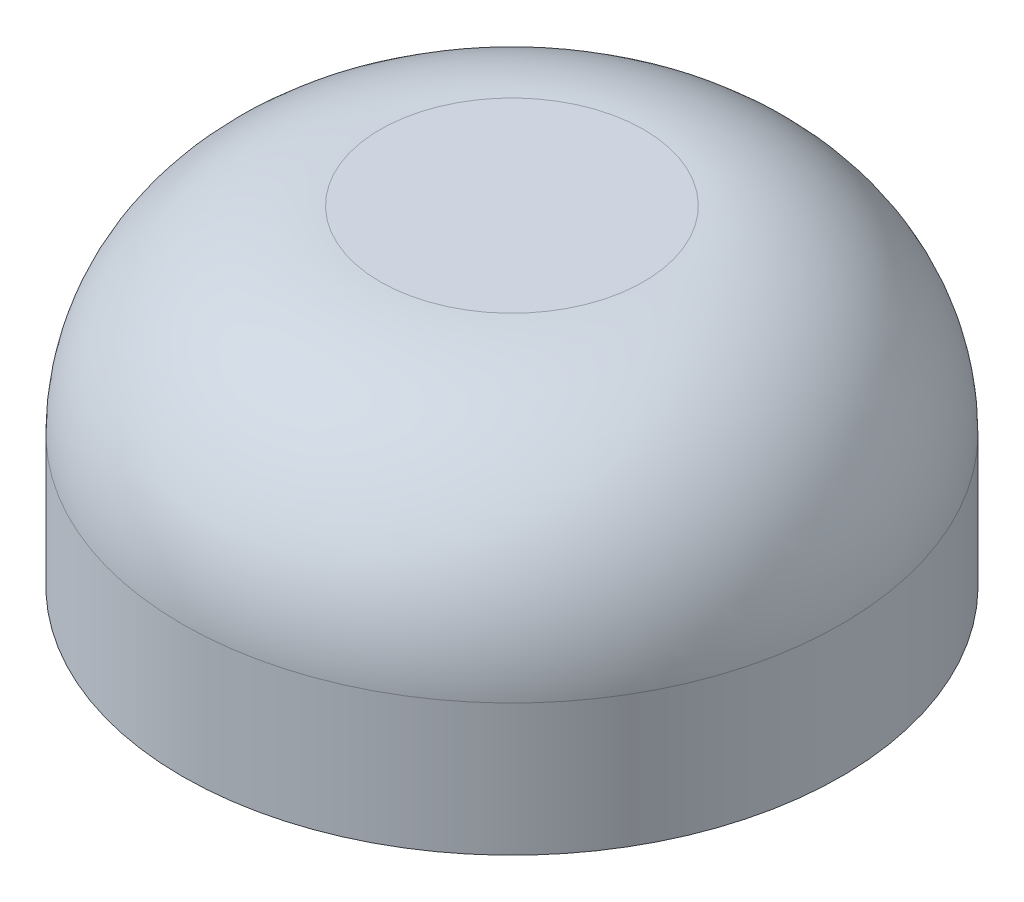
from build123d import *

# Parameters (mm, degrees)
SKETCH1_R           = 10
BOSS_EXTRUDE1_DEPTH = 10
FILLET1_R           = 6


with BuildPart() as part:
    # Sketch1 → Boss-Extrude1 (new body)
    with BuildSketch(Plane(origin=(0, 0, 0), x_dir=(1, 0, 0), z_dir=(0, 1, 0))):
        Circle(SKETCH1_R)
    extrude(amount=BOSS_EXTRUDE1_DEPTH)

    # Fillet1
    fillet1_edges = [part.edges().sort_by_distance(p)[0] for p in [
        (-10, 10, 0),
    ]]
    fillet(fillet1_edges, radius=FILLET1_R)


solid = part.part
